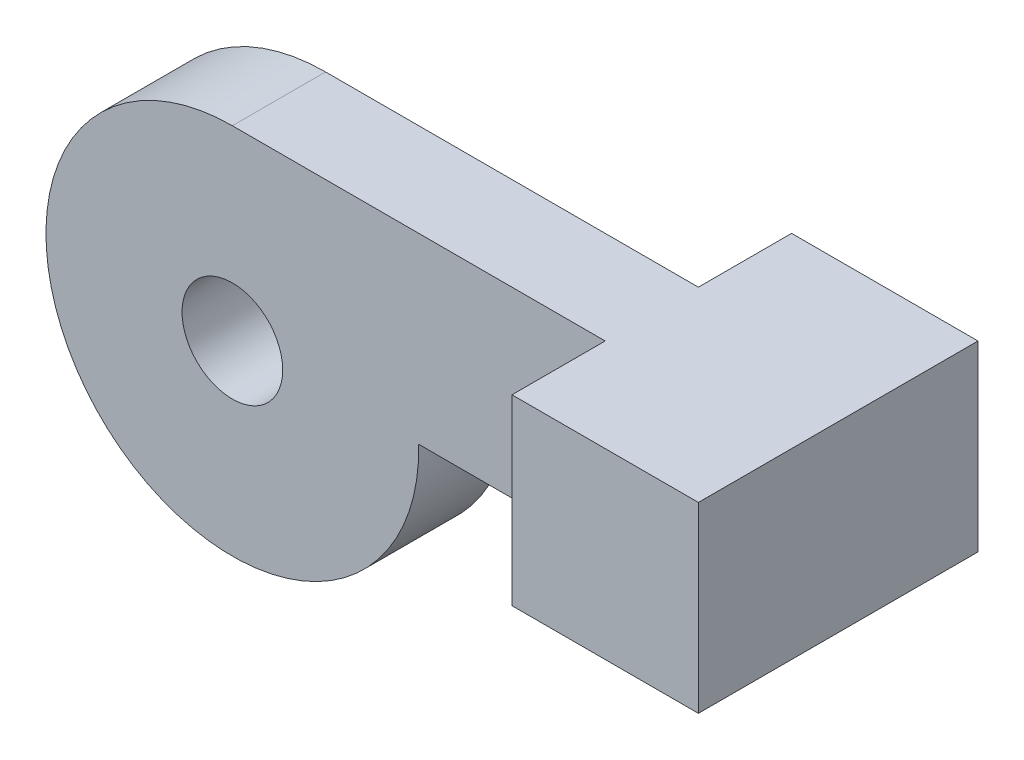
from build123d import *

# Parameters (mm, degrees)
SKETCH1_R           = 3.429
BOSS_EXTRUDE1_DEPTH = 3.175
SKETCH2_W           = 12.7
SKETCH2_H           = 12.446
BOSS_EXTRUDE2_DEPTH = 9.525


with BuildPart() as part:
    # Sketch1 → Boss-Extrude1 (new, symmetric)
    with BuildSketch(Plane.XY):
        with BuildLine():
            Line((0, 12.7), (38.1, 12.7))
            Line((38.1, 12.7), (38.1, 0.254))
            Line((38.1, 0.254), (12.697459746, 0.254))
            ThreePointArc((12.697459746, 0.254), (-8.89, -9.069614104), (0, 12.7))
        make_face()
        Circle(SKETCH1_R, mode=Mode.SUBTRACT)
    extrude(amount=BOSS_EXTRUDE1_DEPTH, both=True)

    # Sketch2 → Boss-Extrude2 (add, symmetric)
    with BuildSketch(Plane.XY):
        with Locations((31.75, 6.477)):
            Rectangle(SKETCH2_W, SKETCH2_H)
    extrude(amount=BOSS_EXTRUDE2_DEPTH, both=True)


solid = part.part
